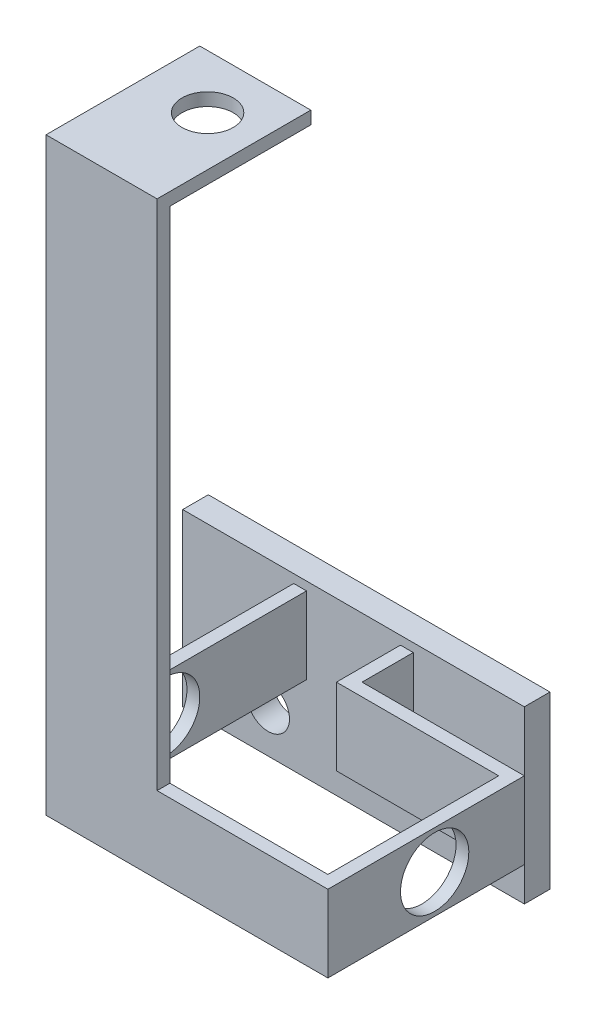
from build123d import *

# Parameters (mm, degrees)
SKETCH1_W               = 7
SKETCH1_H               = 9
BOSS_EXTRUDE2_DEPTH     = 32
SKETCH1_4_R             = 2.5
BOSS_EXTRUDE3_DEPTH     = 3
CUT_EXTRUDE1_DEPTH      = 55.635153519
CUT_EXTRUDE1_DEPTH_BACK = 55.635153519
SKETCH3_W               = 11
SKETCH3_H               = 27.5
SKETCH6_W               = 23
SKETCH6_H               = 9
BOSS_EXTRUDE4_DEPTH     = 19
CUT_EXTRUDE3_DEPTH      = 60.16924877
CUT_EXTRUDE3_DEPTH_BACK = 60.16924877
SKETCH9_W               = 19
SKETCH9_H               = 20
CUT_EXTRUDE4_DEPTH      = 51.129831438
CUT_EXTRUDE4_DEPTH_BACK = 51.129831438
SKETCH12_R              = 4
SKETCH14_W              = 13
SKETCH14_H              = 10
BOSS_EXTRUDE6_DEPTH     = 60
SKETCH17_W              = 11.5
SKETCH17_H              = 8.5
CUT_EXTRUDE6_DEPTH      = 58.5
SKETCH18_W              = 13
SKETCH18_H              = 1.5
BOSS_EXTRUDE7_DEPTH     = 8
SKETCH19_R              = 3
CUT_EXTRUDE7_DEPTH      = 1.5
SKETCH20_W              = 8.5
SKETCH20_H              = 35
CUT_EXTRUDE8_DEPTH      = 1.5
FILLET1_R               = 10


with BuildPart() as part:
    # Sketch1 → Boss-Extrude2 (new body)
    with BuildSketch(Plane.XY):
        with Locations((23.5, 14.5)):
            Rectangle(SKETCH1_W, SKETCH1_H)
        with Locations((16.5, 14.5)):
            Rectangle(SKETCH1_W, SKETCH1_H)
    extrude(amount=BOSS_EXTRUDE2_DEPTH)

    # Sketch1<4> → Boss-Extrude3 (add)
    # profile 1 of 2: a face of its own
    with BuildSketch(Plane.XY):
        Polygon((0, 0), (20, 0), (20, 10), (13, 10), (13, 19), (20, 19), (20, 20), (0, 20), align=None)
        with Locations((10, 5)):
            Circle(SKETCH1_4_R, mode=Mode.SUBTRACT)
    # profile 2 of 2: a face of its own
    with BuildSketch(Plane.XY):
        Polygon((20, 10), (20, 0), (40, 0), (40, 20), (20, 20), (20, 19), (27, 19), (27, 10), align=None)
        with Locations((30, 5)):
            Circle(SKETCH1_4_R, mode=Mode.SUBTRACT)
    extrude(amount=BOSS_EXTRUDE3_DEPTH)

    # Sketch3 → Cut-Extrude1 (cut, two sides: drawn at the far end of the back side and taken through both)
    with BuildSketch(Plane(origin=(0, 19, 0), x_dir=(1, 0, 0), z_dir=(0, 1, 0)).offset(-CUT_EXTRUDE1_DEPTH_BACK)):
        with Locations((20, -16.75)):
            Rectangle(SKETCH3_W, SKETCH3_H)
    extrude(amount=CUT_EXTRUDE1_DEPTH + CUT_EXTRUDE1_DEPTH_BACK, mode=Mode.SUBTRACT)

    # Sketch6 → Boss-Extrude4 (add)
    with BuildSketch(Plane(origin=(27, 0, 0), x_dir=(0, 0, -1), z_dir=(1, 0, 0))):
        with Locations((-20.5, 14.5)):
            Rectangle(SKETCH6_W, SKETCH6_H)
    extrude(amount=BOSS_EXTRUDE4_DEPTH)

    # Sketch9 → Cut-Extrude3 (cut, two sides: drawn at the far end of the back side and taken through both)
    with BuildSketch(Plane(origin=(0, 19, 0), x_dir=(1, 0, 0), z_dir=(0, 1, 0)).offset(-CUT_EXTRUDE3_DEPTH_BACK)):
        with Locations((35, -20.5)):
            Rectangle(SKETCH9_W, SKETCH9_H)
    extrude(amount=CUT_EXTRUDE3_DEPTH + CUT_EXTRUDE3_DEPTH_BACK, mode=Mode.SUBTRACT)

    # Sketch12 → Cut-Extrude4 (cut, two sides: drawn at the far end of the back side and taken through both)
    with BuildSketch(Plane.ZY.offset(-13).offset(-CUT_EXTRUDE4_DEPTH_BACK)):
        with Locations(Location((19.5, 14.5, 0), (0, 0, 270))):
            Circle(SKETCH12_R)
    extrude(amount=CUT_EXTRUDE4_DEPTH + CUT_EXTRUDE4_DEPTH_BACK, mode=Mode.SUBTRACT)

    # Sketch14 → Boss-Extrude6 (add)
    with BuildSketch(Plane(origin=(0, 19, 0), x_dir=(1, 0, 0), z_dir=(0, 1, 0))):
        with Locations((19.5, -27)):
            Rectangle(SKETCH14_W, SKETCH14_H)
    extrude(amount=BOSS_EXTRUDE6_DEPTH)

    # Sketch17 → Cut-Extrude6 (cut)
    with BuildSketch(Plane.XZ.offset(-19)):
        with Locations((20.25, 26.25)):
            Rectangle(SKETCH17_W, SKETCH17_H)
    extrude(amount=-CUT_EXTRUDE6_DEPTH, mode=Mode.SUBTRACT)

    # Sketch18 → Boss-Extrude7 (add)
    with BuildSketch(Plane(origin=(0, 0, 22), x_dir=(-1, 0, 0), z_dir=(0, 0, -1))):
        with Locations((-19.5, 78.25)):
            Rectangle(SKETCH18_W, SKETCH18_H)
    extrude(amount=BOSS_EXTRUDE7_DEPTH)

    # Sketch19 → Cut-Extrude7 (cut)
    with BuildSketch(Plane(origin=(0, 79, 0), x_dir=(1, 0, 0), z_dir=(0, 1, 0))):
        with Locations(Location((20.2198624, -20.303001359, 0), (0, 0, 270))):
            Circle(SKETCH19_R)
    extrude(amount=-CUT_EXTRUDE7_DEPTH, mode=Mode.SUBTRACT)

    # Sketch20 → Cut-Extrude8 (cut)
    with BuildSketch(Plane(origin=(14.5, 0, 0), x_dir=(0, 0, -1), z_dir=(1, 0, 0))):
        with Locations((-26.25, 60)):
            Rectangle(SKETCH20_W, SKETCH20_H)
    extrude(amount=-CUT_EXTRUDE8_DEPTH, mode=Mode.SUBTRACT)

    # Fillet1
    # the kernel refuses this fillet: 10 mm, written as the material it adds along each edge
    with BuildSketch(Plane(origin=(14.5, 42.5, 30.5), x_dir=(0, 0, -1), z_dir=(-1, 0, 0))) as fillet1_piece_1:
        with BuildLine():
            CenterArc((10, -9.886859967), FILLET1_R, 98.626926559, 81.373073441)
            Line((0, -9.886859967), (-0.2, -9.886859967))
            Line((-0.2, -9.886859967), (-0.2, 0))
            Line((-0.2, 0), (0, 0.2))
            ThreePointArc((0, 0.2), (4.25, 0.2), (8.47, 0.197737199))
            Line((8.47, 0.197737199), (8.5, 0))
        make_face()
    extrude(amount=1.5)


solid = part.part
